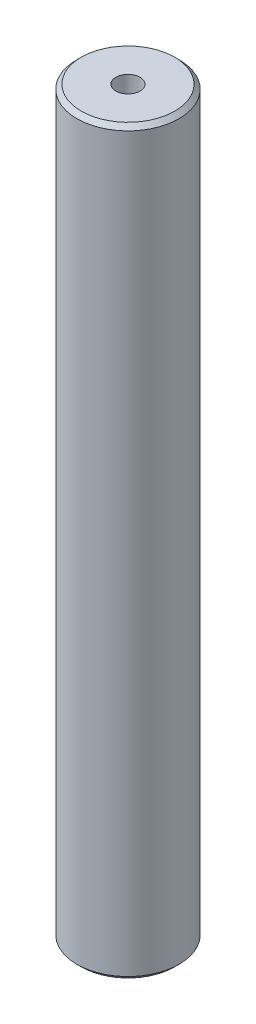
from build123d import *

# Parameters (mm, degrees)
SKETCH1_R           = 5
BOSS_EXTRUDE1_DEPTH = 72.53067568
SKETCH2_R           = 1.180134721
CUT_EXTRUDE1_DEPTH  = 73.874542294
CHAMFER1_SIZE       = 0.426095233


with BuildPart() as part:
    # Sketch1 → Boss-Extrude1 (new body)
    with BuildSketch(Plane(origin=(0, 0, 0), x_dir=(1, 0, 0), z_dir=(0, 1, 0))):
        Circle(SKETCH1_R)
    extrude(amount=BOSS_EXTRUDE1_DEPTH)

    # Sketch2 → Cut-Extrude1 (cut, through all)
    with BuildSketch(Plane(origin=(0, 0, 0), x_dir=(1, 0, 0), z_dir=(0, 1, 0))):
        Circle(SKETCH2_R)
    extrude(amount=CUT_EXTRUDE1_DEPTH, mode=Mode.SUBTRACT)

    # Chamfer1
    chamfer1_edges = [part.edges().sort_by_distance(p)[0] for p in [
        (-5, 72.53067568, 0),
        (-5, 0, 0),
    ]]
    chamfer(chamfer1_edges, length=CHAMFER1_SIZE)


solid = part.part
